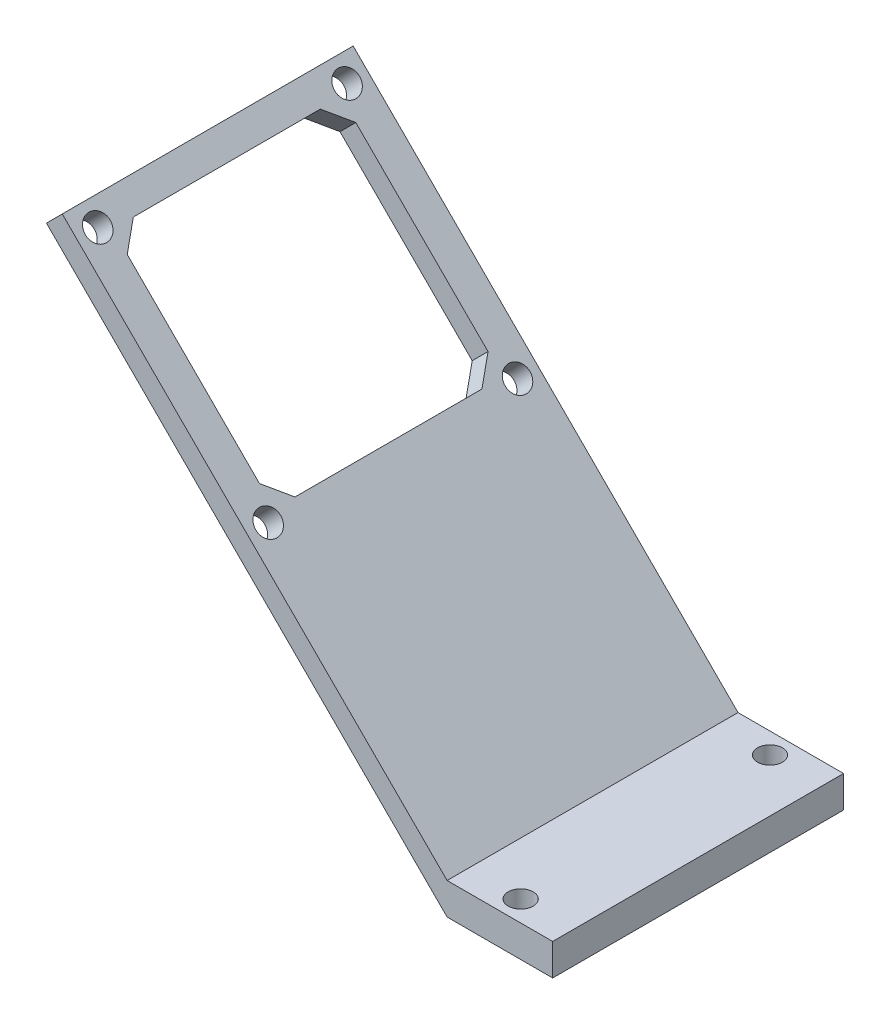
from build123d import *

# Parameters (mm, degrees)
BOSS_EXTRUDE1_DEPTH   = 35
CUT_EXTRUDE1_DEPTH    = 76.449768563
F_3_0MM_DOWEL_HOLE1_D = 3
F_3_0MM_DOWEL_HOLE2_D = 3


with BuildPart() as part:
    # Sketch2 → Boss-Extrude1 (new body)
    with BuildSketch(Plane.XY):
        Polygon((0, 0), (-46.301352032, 46.301352032), (-48.206352032, 44.396352032), (0, -3.81), (12.7, -3.81), (12.7, 0), align=None)
    extrude(amount=BOSS_EXTRUDE1_DEPTH)

    # Sketch3 → Cut-Extrude1 (cut, through all)
    with BuildSketch(Plane(origin=(0, 0, 0), x_dir=(0.7071067811865519, -0.7071067811865432, 0), z_dir=(0.7071067811865432, 0.7071067811865519, 0))):
        Polygon((-59.73, -3.75), (-62.23, -6.25), (-62.23, -28.75), (-59.73, -31.25), (-37.23, -31.25), (-34.73, -28.75), (-34.73, -6.25), (-37.23, -3.75), align=None)
    extrude(amount=-CUT_EXTRUDE1_DEPTH, mode=Mode.SUBTRACT)

    # Ø3.0mm Dowel Hole1 (through all)
    with Locations(Plane(origin=(-44.533585079, 44.533585079, 2.5), x_dir=(0.707106781187, -0.707106781187, 0), z_dir=(0.707106781187, 0.707106781187, 0))):
        with Locations((0, 0), (29, 0), (29, -30), (0, -30)):
            Hole(F_3_0MM_DOWEL_HOLE1_D / 2)

    # Ø3.0mm Dowel Hole2 (through all)
    with Locations(Plane(origin=(6.35, 0, 2.5), x_dir=(1, 0, 0), z_dir=(0, 1, 0))):
        with Locations((0, 0), (0, -30)):
            Hole(F_3_0MM_DOWEL_HOLE2_D / 2)


solid = part.part
